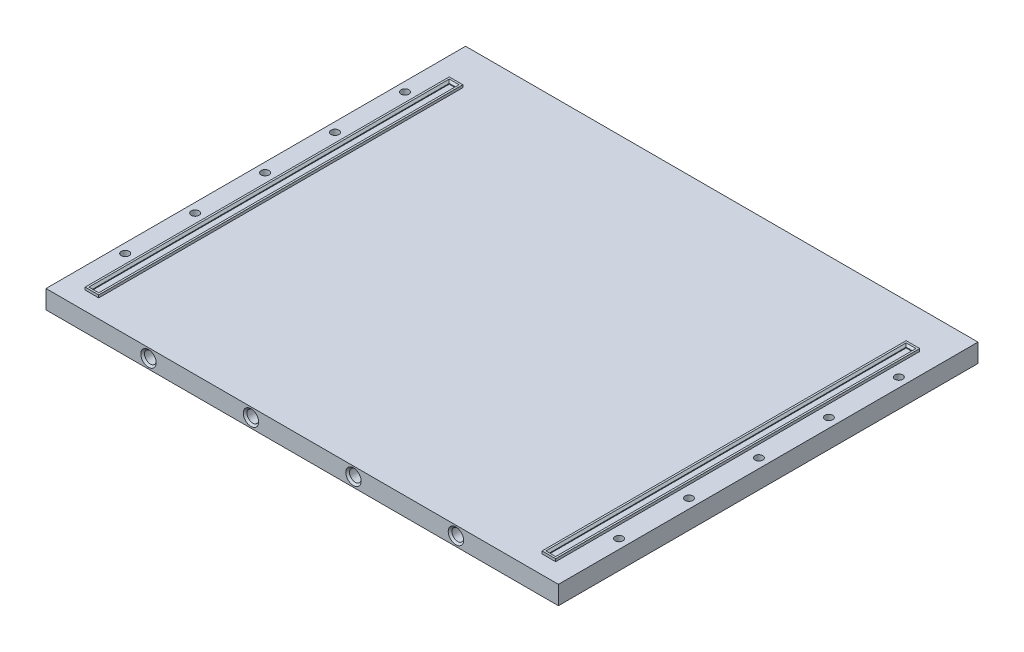
from build123d import *

# Parameters (mm, degrees)
SKETCH_1_W             = 138
SKETCH_1_H             = 113
EXTRUDE_301_DEPTH      = 5
SKETCH_2_W             = 3.65
SKETCH_2_H             = 98.05
SKETCH_2_W_2           = 1.65
SKETCH_2_H_2           = 96.05
EXTRUDE_2092_DEPTH     = 0.7
CHAMFER_2147_SIZE      = 0.5
CHAMFER_2335_SIZE      = 0.5
SKETCH_3_R             = 1.575
CUT_EXTRUDE_2766_DEPTH = 4.2
CUT_EXTRUDE_3301_REACH = 91.363
SKETCH_4_R             = 1.05
SKETCH_5_R             = 2
CUT_EXTRUDE_3811_DEPTH = 3
CHAMFER_3856_SIZE      = 0.5


with BuildPart() as part:
    # Эскиз1 → Extrude 301 (new body)
    with BuildSketch(Plane(origin=(0, 0, 0), x_dir=(1, 0, 0), z_dir=(0, 1, 0))):
        Rectangle(SKETCH_1_W, SKETCH_1_H)
    extrude(amount=EXTRUDE_301_DEPTH)

    # Эскиз2 → Extrude 2092 (add)
    # profile 1 of 2: a face of its own
    with BuildSketch(Plane(origin=(0, 5, 0), x_dir=(1, 0, 0), z_dir=(0, 1, 0))):
        with Locations((-61.525, -2.575)):
            Rectangle(SKETCH_2_W, SKETCH_2_H)
        with Locations((-61.525, -2.575)):
            Rectangle(SKETCH_2_W_2, SKETCH_2_H_2, mode=Mode.SUBTRACT)
    # profile 2 of 2: a face of its own
    with BuildSketch(Plane(origin=(0, 5, 0), x_dir=(1, 0, 0), z_dir=(0, 1, 0))):
        with Locations((61.525, -2.575)):
            Rectangle(SKETCH_2_W, SKETCH_2_H)
        with Locations((61.525, -2.575)):
            Rectangle(SKETCH_2_W_2, SKETCH_2_H_2, mode=Mode.SUBTRACT)
    extrude(amount=EXTRUDE_2092_DEPTH)

    # Chamfer 2147
    chamfer_2147_edges = [part.edges().sort_by_distance(p)[0] for p in [
        (-61.525, 5.7, -45.45),
        (-60.7, 5.7, 2.575),
        (-61.525, 5.7, 50.6),
        (-62.35, 5.7, 2.575),
    ]]
    chamfer(chamfer_2147_edges, length=CHAMFER_2147_SIZE)

    # Chamfer 2335
    chamfer_2335_edges = [part.edges().sort_by_distance(p)[0] for p in [
        (61.525, 5.7, 50.6),
        (60.7, 5.7, 2.575),
        (61.525, 5.7, -45.45),
        (62.35, 5.7, 2.575),
    ]]
    chamfer(chamfer_2335_edges, length=CHAMFER_2335_SIZE)

    # Эскиз3 → Cut-Extrude 2766 (cut)
    with BuildSketch(Plane(origin=(0, 0, -56.5), x_dir=(-1, 0, 0), z_dir=(0, 0, -1))):
        with Locations((-41.4, 2.5)):
            Circle(SKETCH_3_R)
        with Locations((-13.8, 2.5)):
            Circle(SKETCH_3_R)
        with Locations((13.8, 2.5)):
            Circle(SKETCH_3_R)
        with Locations((41.4, 2.5)):
            Circle(SKETCH_3_R)
    cut_extrude_2766 = extrude(amount=-CUT_EXTRUDE_2766_DEPTH, mode=Mode.SUBTRACT)

    # Зеркальное отражение1: Cut-Extrude 2766 across plane
    add(cut_extrude_2766.mirror(Plane(origin=(0, 0, 0), x_dir=(1, 0, 0), z_dir=(0, 0, -1))), mode=Mode.SUBTRACT)

    # Эскиз4 → Cut-Extrude 3301 (cut, up to next)
    with BuildSketch(Plane.XZ, mode=Mode.PRIVATE) as cut_extrude_3301_sk1:
        with Locations((-66.5, 37.666666667)):
            Circle(SKETCH_4_R)
    cut_extrude_3301_tool1 = extrude(cut_extrude_3301_sk1.sketch, amount=-CUT_EXTRUDE_3301_REACH, mode=Mode.PRIVATE) & part.part
    # Эскиз4 → Cut-Extrude 3301 (cut, up to next)
    with BuildSketch(Plane.XZ, mode=Mode.PRIVATE) as cut_extrude_3301_sk2:
        with Locations((-66.5, 18.833333333)):
            Circle(SKETCH_4_R)
    cut_extrude_3301_tool2 = extrude(cut_extrude_3301_sk2.sketch, amount=-CUT_EXTRUDE_3301_REACH, mode=Mode.PRIVATE) & part.part
    # Эскиз4 → Cut-Extrude 3301 (cut, up to next)
    with BuildSketch(Plane.XZ, mode=Mode.PRIVATE) as cut_extrude_3301_sk3:
        with Locations((-66.5, 0)):
            Circle(SKETCH_4_R)
    cut_extrude_3301_tool3 = extrude(cut_extrude_3301_sk3.sketch, amount=-CUT_EXTRUDE_3301_REACH, mode=Mode.PRIVATE) & part.part
    # Эскиз4 → Cut-Extrude 3301 (cut, up to next)
    with BuildSketch(Plane.XZ, mode=Mode.PRIVATE) as cut_extrude_3301_sk4:
        with Locations((-66.5, -18.833333333)):
            Circle(SKETCH_4_R)
    cut_extrude_3301_tool4 = extrude(cut_extrude_3301_sk4.sketch, amount=-CUT_EXTRUDE_3301_REACH, mode=Mode.PRIVATE) & part.part
    # Эскиз4 → Cut-Extrude 3301 (cut, up to next)
    with BuildSketch(Plane.XZ, mode=Mode.PRIVATE) as cut_extrude_3301_sk5:
        with Locations((-66.5, -37.666666667)):
            Circle(SKETCH_4_R)
    cut_extrude_3301_tool5 = extrude(cut_extrude_3301_sk5.sketch, amount=-CUT_EXTRUDE_3301_REACH, mode=Mode.PRIVATE) & part.part
    # Эскиз4 → Cut-Extrude 3301 (cut, up to next)
    with BuildSketch(Plane.XZ, mode=Mode.PRIVATE) as cut_extrude_3301_sk6:
        with Locations((66.5, -37.666666667)):
            Circle(SKETCH_4_R)
    cut_extrude_3301_tool6 = extrude(cut_extrude_3301_sk6.sketch, amount=-CUT_EXTRUDE_3301_REACH, mode=Mode.PRIVATE) & part.part
    # Эскиз4 → Cut-Extrude 3301 (cut, up to next)
    with BuildSketch(Plane.XZ, mode=Mode.PRIVATE) as cut_extrude_3301_sk7:
        with Locations((66.5, -18.833333333)):
            Circle(SKETCH_4_R)
    cut_extrude_3301_tool7 = extrude(cut_extrude_3301_sk7.sketch, amount=-CUT_EXTRUDE_3301_REACH, mode=Mode.PRIVATE) & part.part
    # Эскиз4 → Cut-Extrude 3301 (cut, up to next)
    with BuildSketch(Plane.XZ, mode=Mode.PRIVATE) as cut_extrude_3301_sk8:
        with Locations((66.5, 0)):
            Circle(SKETCH_4_R)
    cut_extrude_3301_tool8 = extrude(cut_extrude_3301_sk8.sketch, amount=-CUT_EXTRUDE_3301_REACH, mode=Mode.PRIVATE) & part.part
    # Эскиз4 → Cut-Extrude 3301 (cut, up to next)
    with BuildSketch(Plane.XZ, mode=Mode.PRIVATE) as cut_extrude_3301_sk9:
        with Locations((66.5, 18.833333333)):
            Circle(SKETCH_4_R)
    cut_extrude_3301_tool9 = extrude(cut_extrude_3301_sk9.sketch, amount=-CUT_EXTRUDE_3301_REACH, mode=Mode.PRIVATE) & part.part
    # Эскиз4 → Cut-Extrude 3301 (cut, up to next)
    with BuildSketch(Plane.XZ, mode=Mode.PRIVATE) as cut_extrude_3301_sk10:
        with Locations((66.5, 37.666666667)):
            Circle(SKETCH_4_R)
    cut_extrude_3301_tool10 = extrude(cut_extrude_3301_sk10.sketch, amount=-CUT_EXTRUDE_3301_REACH, mode=Mode.PRIVATE) & part.part
    add(cut_extrude_3301_tool1.solids().sort_by_distance((-66.5, 0, 37.666667))[0], mode=Mode.SUBTRACT)
    add(cut_extrude_3301_tool2.solids().sort_by_distance((-66.5, 0, 18.833333))[0], mode=Mode.SUBTRACT)
    add(cut_extrude_3301_tool3.solids().sort_by_distance((-66.5, 0, 0))[0], mode=Mode.SUBTRACT)
    add(cut_extrude_3301_tool4.solids().sort_by_distance((-66.5, 0, -18.833333))[0], mode=Mode.SUBTRACT)
    add(cut_extrude_3301_tool5.solids().sort_by_distance((-66.5, 0, -37.666667))[0], mode=Mode.SUBTRACT)
    add(cut_extrude_3301_tool6.solids().sort_by_distance((66.5, 0, -37.666667))[0], mode=Mode.SUBTRACT)
    add(cut_extrude_3301_tool7.solids().sort_by_distance((66.5, 0, -18.833333))[0], mode=Mode.SUBTRACT)
    add(cut_extrude_3301_tool8.solids().sort_by_distance((66.5, 0, 0))[0], mode=Mode.SUBTRACT)
    add(cut_extrude_3301_tool9.solids().sort_by_distance((66.5, 0, 18.833333))[0], mode=Mode.SUBTRACT)
    add(cut_extrude_3301_tool10.solids().sort_by_distance((66.5, 0, 37.666667))[0], mode=Mode.SUBTRACT)

    # Эскиз5 → Cut-Extrude 3811 (cut)
    with BuildSketch(Plane.XZ):
        with Locations((-66.5, 37.666666667)):
            Circle(SKETCH_5_R)
        with Locations((-66.5, 18.833333333)):
            Circle(SKETCH_5_R)
        with Locations((-66.5, 0)):
            Circle(SKETCH_5_R)
        with Locations((-66.5, -18.833333333)):
            Circle(SKETCH_5_R)
        with Locations((-66.5, -37.666666667)):
            Circle(SKETCH_5_R)
        with Locations((66.5, -37.666666667)):
            Circle(SKETCH_5_R)
        with Locations((66.5, -18.833333333)):
            Circle(SKETCH_5_R)
        with Locations((66.5, 0)):
            Circle(SKETCH_5_R)
        with Locations((66.5, 18.833333333)):
            Circle(SKETCH_5_R)
        with Locations((66.5, 37.666666667)):
            Circle(SKETCH_5_R)
    extrude(amount=-CUT_EXTRUDE_3811_DEPTH, mode=Mode.SUBTRACT)

    # Chamfer 3856
    chamfer_3856_edges = [part.edges().sort_by_distance(p)[0] for p in [
        (42.975, 2.5, 56.5),
        (15.375, 2.5, 56.5),
        (-12.225, 2.5, 56.5),
        (-39.825, 2.5, 56.5),
        (-39.825, 2.5, -56.5),
        (-12.225, 2.5, -56.5),
        (15.375, 2.5, -56.5),
        (42.975, 2.5, -56.5),
    ]]
    chamfer(chamfer_3856_edges, length=CHAMFER_3856_SIZE)


solid = part.part
